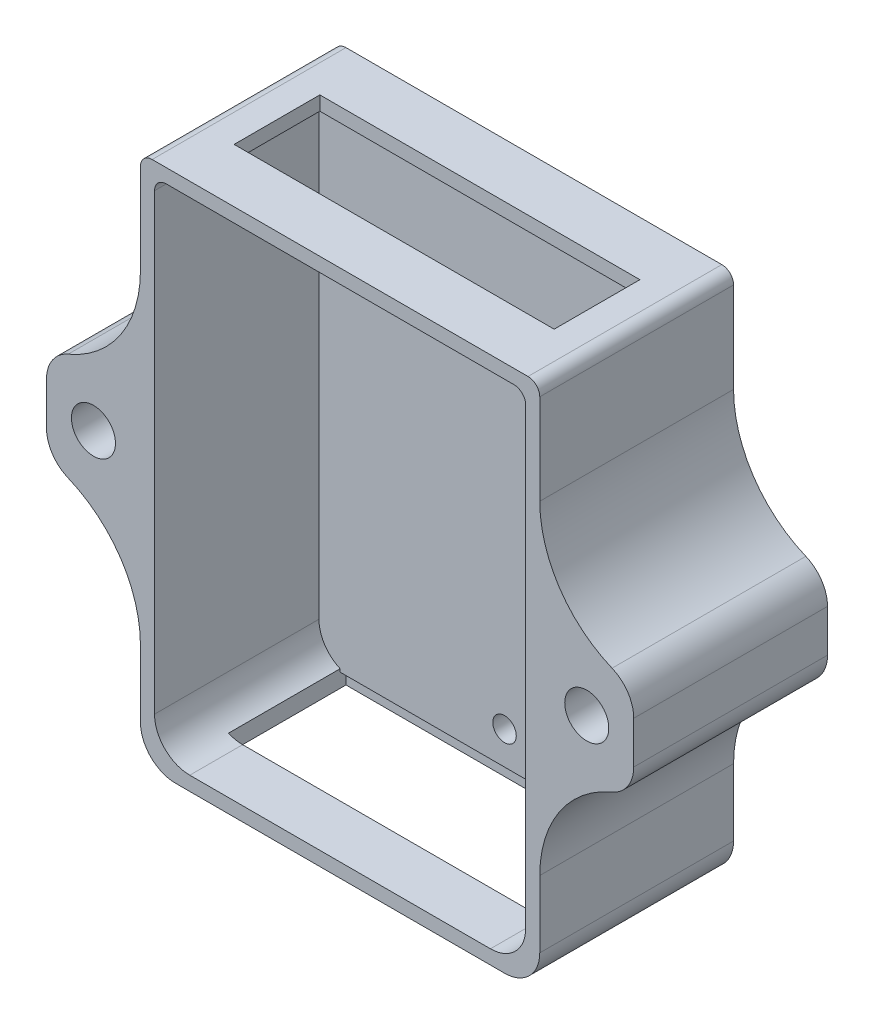
from build123d import *

# Parameters (mm, degrees)
SKETCH1_W           = 34
SKETCH1_H           = 45
SKETCH1_R           = 1
BOSS_EXTRUDE1_DEPTH = 2.5
SKETCH2_W           = 34
SKETCH2_H           = 45
SKETCH2_W_2         = 31.6
SKETCH2_H_2         = 42.6
BOSS_EXTRUDE2_DEPTH = 14
SKETCH7_W           = 28
SKETCH7_H           = 10
CUT_EXTRUDE2_DEPTH  = 1.2
CUT_EXTRUDE3_REACH  = 60.764
SKETCH9_W           = 27.25
SKETCH9_H           = 7.3
SKETCH10_W          = 8
SKETCH10_H          = 8
SKETCH10_R          = 1.875
BOSS_EXTRUDE3_DEPTH = 16.5
FILLET1_R           = 10
FILLET2_R           = 3
FILLET3_R           = 1
CUT_EXTRUDE4_DEPTH  = 3
CHAMFER1_SIZE       = 3
CHAMFER1_SIZE_2     = 1.732050808


with BuildPart() as part:
    # Sketch1 → Boss-Extrude1 (new body)
    with BuildSketch(Plane.XY):
        with Locations((17, 22.5)):
            Rectangle(SKETCH1_W, SKETCH1_H)
        with Locations((17, 4)):
            Circle(SKETCH1_R, mode=Mode.SUBTRACT)
    extrude(amount=BOSS_EXTRUDE1_DEPTH)

    # Sketch2 → Boss-Extrude2 (add)
    with BuildSketch(Plane.XY.offset(2.5)):
        with Locations((17, 22.5)):
            Rectangle(SKETCH2_W, SKETCH2_H)
        with Locations((17, 22.5)):
            Rectangle(SKETCH2_W_2, SKETCH2_H_2, mode=Mode.SUBTRACT)
    extrude(amount=BOSS_EXTRUDE2_DEPTH)

    # Sketch7 → Cut-Extrude2 (cut)
    with BuildSketch(Plane(origin=(0, 0, 0), x_dir=(-1, 0, 0), z_dir=(0, -1, 0))):
        with Locations((-17, -7)):
            Rectangle(SKETCH7_W, SKETCH7_H)
    extrude(amount=-CUT_EXTRUDE2_DEPTH, mode=Mode.SUBTRACT)

    # Sketch9 → Cut-Extrude3 (cut, up to next)
    with BuildSketch(Plane(origin=(0, 45, 0), x_dir=(1, 0, 0), z_dir=(0, 1, 0)), mode=Mode.PRIVATE) as cut_extrude3_sk1:
        with Locations((17, -8.25)):
            Rectangle(SKETCH9_W, SKETCH9_H)
    cut_extrude3_tool1 = extrude(cut_extrude3_sk1.sketch, amount=-CUT_EXTRUDE3_REACH, mode=Mode.PRIVATE) & part.part
    add(cut_extrude3_tool1.solids().sort_by_distance((17, 45, 8.25))[0], mode=Mode.SUBTRACT)

    # Sketch10 → Boss-Extrude3 (add)
    # profile 1 of 2: a face of its own
    with BuildSketch(Plane(origin=(0, 0, 0), x_dir=(-1, 0, 0), z_dir=(0, 0, -1))):
        with Locations((-38, 22.5)):
            Rectangle(SKETCH10_W, SKETCH10_H)
        with Locations((-38, 22.5)):
            Circle(SKETCH10_R, mode=Mode.SUBTRACT)
    # profile 2 of 2: a face of its own
    with BuildSketch(Plane(origin=(0, 0, 0), x_dir=(-1, 0, 0), z_dir=(0, 0, -1))):
        with Locations((4, 22.5)):
            Rectangle(SKETCH10_W, SKETCH10_H)
        with Locations((4, 22.5)):
            Circle(SKETCH10_R, mode=Mode.SUBTRACT)
    extrude(amount=-BOSS_EXTRUDE3_DEPTH)

    # Fillet1
    # the kernel refuses this fillet: 10 mm, written as the material it adds along each edge
    with BuildSketch(Plane(origin=(34, 26.5, 0), x_dir=(0, 1, 0), z_dir=(0, 0, 1)), Plane(origin=(0, 18.5, 0), x_dir=(0, -1, 0), z_dir=(0, 0, 1))) as fillet1_piece_1:
        with BuildLine():
            CenterArc((9.797958971, -10), FILLET1_R, 90, 78.463040967)
            Line((0, -8), (-0.195959179, -7.96))
            ThreePointArc((-0.195959179, -7.96), (-0.2, -4), (-0.2, 0))
            Line((-0.2, 0), (0, 0.2))
            Line((0, 0.2), (9.797958971, 0.2))
            Line((9.797958971, 0.2), (9.797958971, 0))
        make_face()
    extrude(amount=16.5)
    with BuildSketch(Plane(origin=(34, 18.5, 0), x_dir=(0, -1, 0), z_dir=(0, 0, 1)), Plane(origin=(0, 26.5, 0), x_dir=(0, 1, 0), z_dir=(0, 0, 1))) as fillet1_piece_2:
        with BuildLine():
            CenterArc((9.797958971, 10), FILLET1_R, 191.536959033, 78.463040967)
            Line((0, 8), (-0.195959179, 7.96))
            ThreePointArc((-0.195959179, 7.96), (-0.2, 4), (-0.2, 0))
            Line((-0.2, 0), (0, -0.2))
            Line((0, -0.2), (9.797958971, -0.2))
            Line((9.797958971, -0.2), (9.797958971, 0))
        make_face()
    extrude(amount=16.5)

    # Fillet2
    # the kernel refuses this fillet: 3 mm, written as the material it adds along each edge
    with BuildSketch(Plane(origin=(32.8, 1.2, 2.5), x_dir=(-1, 0, 0), z_dir=(0, 0, 1))) as fillet2_piece_1_section:
        with BuildLine():
            CenterArc((FILLET2_R, -FILLET2_R), FILLET2_R, 90, 90)
            Line((0, -FILLET2_R), (0, 0))
            Line((0, 0), (FILLET2_R, 0))
        make_face()
    fillet2_piece_1 = extrude(amount=14, mode=Mode.PRIVATE)
    fillet2_piece_1 = split(fillet2_piece_1, bisect_by=Plane(origin=(31, 1.931235527, 7.25), z_dir=(1, 0, 0)), keep=Keep.TOP, mode=Mode.PRIVATE)
    fillet2_piece_1 = split(fillet2_piece_1, bisect_by=Plane(origin=(32.244849809, 1.931235527, 12), z_dir=(0, 0, -1)), keep=Keep.TOP, mode=Mode.PRIVATE)
    add(fillet2_piece_1)
    with BuildSketch(Plane(origin=(32.8, 1.2, 2.5), x_dir=(-1, 0, 0), z_dir=(0, 0, 1))) as fillet2_piece_2_section:
        with BuildLine():
            CenterArc((FILLET2_R, -FILLET2_R), FILLET2_R, 90, 90)
            Line((0, -FILLET2_R), (0, 0))
            Line((0, 0), (FILLET2_R, 0))
        make_face()
    fillet2_piece_2 = extrude(amount=14, mode=Mode.PRIVATE)
    fillet2_piece_2 = split(fillet2_piece_2, bisect_by=Plane(origin=(31, 1.230395544, 14.25), z_dir=(-1, 0, 0)), keep=Keep.TOP, mode=Mode.PRIVATE)
    fillet2_piece_2 = split(fillet2_piece_2, bisect_by=Plane(origin=(30.574754002, 1.230395544, 12), z_dir=(0, 0, 1)), keep=Keep.TOP, mode=Mode.PRIVATE)
    add(fillet2_piece_2)
    with BuildSketch(Plane(origin=(32.8, 1.2, 2.5), x_dir=(-1, 0, 0), z_dir=(0, 0, 1))) as fillet2_piece_3_section:
        with BuildLine():
            CenterArc((FILLET2_R, -FILLET2_R), FILLET2_R, 90, 90)
            Line((0, -FILLET2_R), (0, 0))
            Line((0, 0), (FILLET2_R, 0))
        make_face()
    fillet2_piece_3 = extrude(amount=14, mode=Mode.PRIVATE)
    fillet2_piece_3 = split(fillet2_piece_3, bisect_by=Plane(origin=(31, 1.931235527, 14.25), z_dir=(1, 0, 0)), keep=Keep.TOP, mode=Mode.PRIVATE)
    fillet2_piece_3 = split(fillet2_piece_3, bisect_by=Plane(origin=(32.244849809, 1.931235527, 12), z_dir=(0, 0, 1)), keep=Keep.TOP, mode=Mode.PRIVATE)
    add(fillet2_piece_3)
    with BuildSketch(Plane(origin=(1.2, 1.2, 2.5), x_dir=(0, 1, 0), z_dir=(0, 0, 1))) as fillet2_piece_4_section:
        with BuildLine():
            CenterArc((FILLET2_R, -FILLET2_R), FILLET2_R, 90, 90)
            Line((0, -FILLET2_R), (0, 0))
            Line((0, 0), (FILLET2_R, 0))
        make_face()
    fillet2_piece_4 = extrude(amount=14, mode=Mode.PRIVATE)
    fillet2_piece_4 = split(fillet2_piece_4, bisect_by=Plane(origin=(1.755150191, 1.931235527, 12), z_dir=(0, 0, -1)), keep=Keep.TOP, mode=Mode.PRIVATE)
    fillet2_piece_4 = split(fillet2_piece_4, bisect_by=Plane(origin=(3, 1.931235527, 7.25), z_dir=(-1, 0, 0)), keep=Keep.TOP, mode=Mode.PRIVATE)
    add(fillet2_piece_4)
    with BuildSketch(Plane(origin=(1.2, 1.2, 2.5), x_dir=(0, 1, 0), z_dir=(0, 0, 1))) as fillet2_piece_5_section:
        with BuildLine():
            CenterArc((FILLET2_R, -FILLET2_R), FILLET2_R, 90, 90)
            Line((0, -FILLET2_R), (0, 0))
            Line((0, 0), (FILLET2_R, 0))
        make_face()
    fillet2_piece_5 = extrude(amount=14, mode=Mode.PRIVATE)
    fillet2_piece_5 = split(fillet2_piece_5, bisect_by=Plane(origin=(1.755150191, 1.931235527, 12), z_dir=(0, 0, 1)), keep=Keep.TOP, mode=Mode.PRIVATE)
    fillet2_piece_5 = split(fillet2_piece_5, bisect_by=Plane(origin=(3, 1.931235527, 14.25), z_dir=(-1, 0, 0)), keep=Keep.TOP, mode=Mode.PRIVATE)
    add(fillet2_piece_5)
    with BuildSketch(Plane(origin=(1.2, 1.2, 2.5), x_dir=(0, 1, 0), z_dir=(0, 0, 1))) as fillet2_piece_6_section:
        with BuildLine():
            CenterArc((FILLET2_R, -FILLET2_R), FILLET2_R, 90, 90)
            Line((0, -FILLET2_R), (0, 0))
            Line((0, 0), (FILLET2_R, 0))
        make_face()
    fillet2_piece_6 = extrude(amount=14, mode=Mode.PRIVATE)
    fillet2_piece_6 = split(fillet2_piece_6, bisect_by=Plane(origin=(3.425245998, 1.230395544, 12), z_dir=(0, 0, 1)), keep=Keep.TOP, mode=Mode.PRIVATE)
    fillet2_piece_6 = split(fillet2_piece_6, bisect_by=Plane(origin=(3, 1.230395544, 14.25), z_dir=(1, 0, 0)), keep=Keep.TOP, mode=Mode.PRIVATE)
    add(fillet2_piece_6)
    # the kernel refuses this fillet: 3 mm, written as the material it takes off along each edge
    with BuildSketch(Plane(origin=(34, 0, -7.5), x_dir=(-1, 0, 0), z_dir=(0, 0, 1))) as fillet2_2_piece_1:
        with BuildLine():
            CenterArc((FILLET2_R, -FILLET2_R), FILLET2_R, 90, 90)
            Line((0, -FILLET2_R), (0, 0))
            Line((0, 0), (FILLET2_R, 0))
        make_face()
    extrude(amount=31.5, mode=Mode.SUBTRACT)
    with BuildSketch(Plane(origin=(0, 0, 24), x_dir=(0, 1, 0), z_dir=(0, 0, -1))) as fillet2_2_piece_2:
        with BuildLine():
            CenterArc((FILLET2_R, FILLET2_R), FILLET2_R, 180, 90)
            Line((0, FILLET2_R), (0, 0))
            Line((0, 0), (FILLET2_R, 0))
        make_face()
    extrude(amount=31.5, mode=Mode.SUBTRACT)
    with BuildSketch(Plane(origin=(42, 26.5, -5.505102572), x_dir=(-0.9559037360078775, 0.2936801789126771, 0), z_dir=(0, 0, 1))) as fillet2_2_piece_3:
        with BuildLine():
            CenterArc((2.221015405, 2.985979783), FILLET2_R, 197.07841199, 67.380135052)
            Line((-0.646695803, 2.104939246), (0, 0))
            ThreePointArc((0, 0), (0.965658872, 0.046734056), (1.931317743, 0))
        make_face()
    extrude(amount=27.510205144, mode=Mode.SUBTRACT)
    with BuildSketch(Plane(origin=(42, 18.5, -5.505102572), x_dir=(-0.9559037360078775, -0.2936801789126771, 0), z_dir=(0, 0, 1)), Plane(origin=(-8, 26.5, -5.505102572), x_dir=(0.9559037360078771, 0.29368017891267806, 0), z_dir=(0, 0, 1))) as fillet2_2_piece_4:
        with BuildLine():
            CenterArc((2.221015405, -2.985979783), FILLET2_R, 95.541452958, 67.380135052)
            Line((-0.646695803, -2.104939246), (0, 0))
            ThreePointArc((0, 0), (0.965658872, -0.046734056), (1.931317743, 0))
        make_face()
    extrude(amount=27.510205144, mode=Mode.SUBTRACT)
    with BuildSketch(Plane(origin=(-8, 18.5, -5.505102572), x_dir=(0, 1, 0), z_dir=(0, 0, 1))) as fillet2_2_piece_5:
        with BuildLine():
            CenterArc((2.202041029, -3), FILLET2_R, 90, 67.380135052)
            ThreePointArc((-0.56718974, -1.846153846), (-0.238921611, -0.936801789), (0, 0))
            Line((0, 0), (2.202041029, 0))
        make_face()
    extrude(amount=27.510205144, mode=Mode.SUBTRACT)

    # Fillet3
    fillet3_edges = [part.edges().sort_by_distance(p)[0] for p in [
        (32.8, 43.8, 9.5),
        (1.2, 43.8, 9.5),
        (34, 45, 8.25),
        (0, 45, 8.25),
    ]]
    fillet(fillet3_edges, radius=FILLET3_R)

    # Sketch11 → Cut-Extrude4 (cut)
    with BuildSketch(Plane(origin=(0, 0, 0), x_dir=(-1, 0, 0), z_dir=(0, 0, -1))):
        Polygon((-38, 19.180235952), (-35.125, 20.840117976), (-35.125, 24.159882024), (-38, 25.819764048), (-40.875, 24.159882024), (-40.875, 20.840117976), align=None)
        Polygon((4, 19.180235952), (6.875, 20.840117976), (6.875, 24.159882024), (4, 25.819764048), (1.125, 24.159882024), (1.125, 20.840117976), align=None)
    extrude(amount=-CUT_EXTRUDE4_DEPTH, mode=Mode.SUBTRACT)

    # Chamfer1
    # the kernel refuses this chamfer: 3, 1.732050808 mm, written as the material it takes off along each edge
    with BuildSketch(Plane(origin=(-4, 22.5, 3), x_dir=(-1, 0, 0), z_dir=(0, -1, 0))) as chamfer1_piece_1_section:
        Polygon((1.875, -CHAMFER1_SIZE), (1.875 + CHAMFER1_SIZE_2, 0), (1.875, 0), align=None)
    chamfer1_piece_1 = revolve(axis=Axis((-4, 22.5, 3), (0, 0, -1)), mode=Mode.PRIVATE)
    chamfer1_piece_1 = split(chamfer1_piece_1, bisect_by=Plane(origin=(-3.533643531, 18.910984919, 4.784069844), z_dir=(0.5000000000000003, 0.8660254037844387, 0)), keep=Keep.TOP, mode=Mode.PRIVATE)
    chamfer1_piece_1 = split(chamfer1_piece_1, bisect_by=Plane(origin=(-6.875, 22.5, 4.784069844), z_dir=(1, 0, 0)), keep=Keep.TOP, mode=Mode.PRIVATE)
    chamfer1_piece_1 = split(chamfer1_piece_1, bisect_by=Plane(origin=(-3.533643531, 26.089015081, 4.784069844), z_dir=(0.4999999999999998, -0.8660254037844388, 0)), keep=Keep.TOP, mode=Mode.PRIVATE)
    chamfer1_piece_1 = split(chamfer1_piece_1, bisect_by=Plane(origin=(-0.658643531, 23.890630991, 4.784069844), z_dir=(-0.5000000000000004, -0.8660254037844385, 0)), keep=Keep.TOP, mode=Mode.PRIVATE)
    chamfer1_piece_1 = split(chamfer1_piece_1, bisect_by=Plane(origin=(-1.125, 22.5, 4.784069844), z_dir=(-1, 0, 0)), keep=Keep.TOP, mode=Mode.PRIVATE)
    chamfer1_piece_1 = split(chamfer1_piece_1, bisect_by=Plane(origin=(-0.658643531, 21.109369009, 4.784069844), z_dir=(-0.5000000000000008, 0.8660254037844383, 0)), keep=Keep.TOP, mode=Mode.PRIVATE)
    add(chamfer1_piece_1, mode=Mode.SUBTRACT)
    with BuildSketch(Plane(origin=(38, 22.5, 3), x_dir=(-1, 0, 0), z_dir=(0, -1, 0))) as chamfer1_piece_2_section:
        Polygon((1.875, -CHAMFER1_SIZE), (1.875 + CHAMFER1_SIZE_2, 0), (1.875, 0), align=None)
    chamfer1_piece_2 = revolve(axis=Axis((38, 22.5, 3), (0, 0, -1)), mode=Mode.PRIVATE)
    chamfer1_piece_2 = split(chamfer1_piece_2, bisect_by=Plane(origin=(38.466356469, 18.910984919, 4.784069844), z_dir=(0.5000000000000004, 0.8660254037844385, 0)), keep=Keep.TOP, mode=Mode.PRIVATE)
    chamfer1_piece_2 = split(chamfer1_piece_2, bisect_by=Plane(origin=(35.125, 22.5, 4.784069844), z_dir=(1, 0, 0)), keep=Keep.TOP, mode=Mode.PRIVATE)
    chamfer1_piece_2 = split(chamfer1_piece_2, bisect_by=Plane(origin=(38.466356469, 26.089015081, 4.784069844), z_dir=(0.4999999999999988, -0.8660254037844394, 0)), keep=Keep.TOP, mode=Mode.PRIVATE)
    chamfer1_piece_2 = split(chamfer1_piece_2, bisect_by=Plane(origin=(41.341356469, 23.890630991, 4.784069844), z_dir=(-0.5000000000000002, -0.8660254037844386, 0)), keep=Keep.TOP, mode=Mode.PRIVATE)
    chamfer1_piece_2 = split(chamfer1_piece_2, bisect_by=Plane(origin=(40.875, 22.5, 4.784069844), z_dir=(-1, 0, 0)), keep=Keep.TOP, mode=Mode.PRIVATE)
    chamfer1_piece_2 = split(chamfer1_piece_2, bisect_by=Plane(origin=(41.341356469, 21.109369009, 4.784069844), z_dir=(-0.4999999999999996, 0.8660254037844389, 0)), keep=Keep.TOP, mode=Mode.PRIVATE)
    add(chamfer1_piece_2, mode=Mode.SUBTRACT)


solid = part.part
